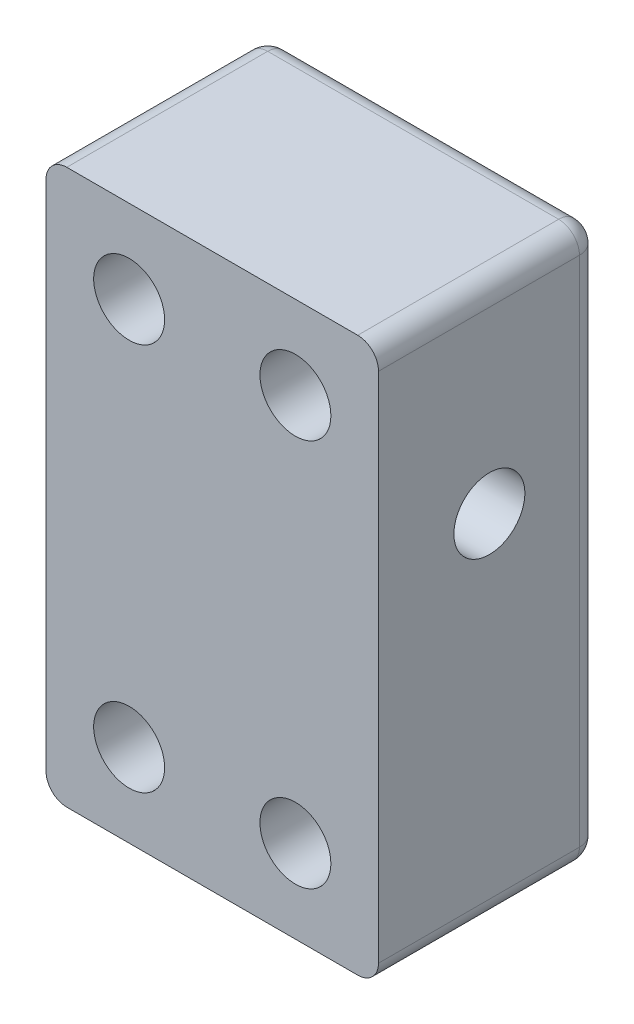
from build123d import *

# Parameters (mm, degrees)
SKETCH1_W           = 19.05
SKETCH1_H           = 31.75
SKETCH1_R           = 2.032
BOSS_EXTRUDE1_DEPTH = 12.7
SKETCH2_R           = 2.032
CUT_EXTRUDE1_DEPTH  = 40.144028919
FILLET1_R           = 1.190625


with BuildPart() as part:
    # Sketch1 → Boss-Extrude1 (new body)
    with BuildSketch(Plane.XY):
        with Locations((9.525, 15.875)):
            Rectangle(SKETCH1_W, SKETCH1_H)
        with Locations((4.7625, 26.9875)):
            Circle(SKETCH1_R, mode=Mode.SUBTRACT)
        with Locations((14.2875, 26.9875)):
            Circle(SKETCH1_R, mode=Mode.SUBTRACT)
        with Locations((4.7625, 4.7625)):
            Circle(SKETCH1_R, mode=Mode.SUBTRACT)
        with Locations((14.2875, 4.7625)):
            Circle(SKETCH1_R, mode=Mode.SUBTRACT)
    extrude(amount=BOSS_EXTRUDE1_DEPTH)

    # Sketch2 → Cut-Extrude1 (cut, through all)
    with BuildSketch(Plane.ZY):
        with Locations((6.35, 20.32)):
            Circle(SKETCH2_R)
    extrude(amount=-CUT_EXTRUDE1_DEPTH, mode=Mode.SUBTRACT)

    # Fillet1
    fillet1_edges = [part.edges().sort_by_distance(p)[0] for p in [
        (9.525, 0, 0),
        (9.525, 31.75, 0),
        (19.05, 15.875, 0),
        (0, 15.875, 0),
        (0, 0, 6.35),
        (19.05, 0, 6.35),
        (0, 31.75, 6.35),
        (19.05, 31.75, 6.35),
    ]]
    fillet(fillet1_edges, radius=FILLET1_R)


solid = part.part
